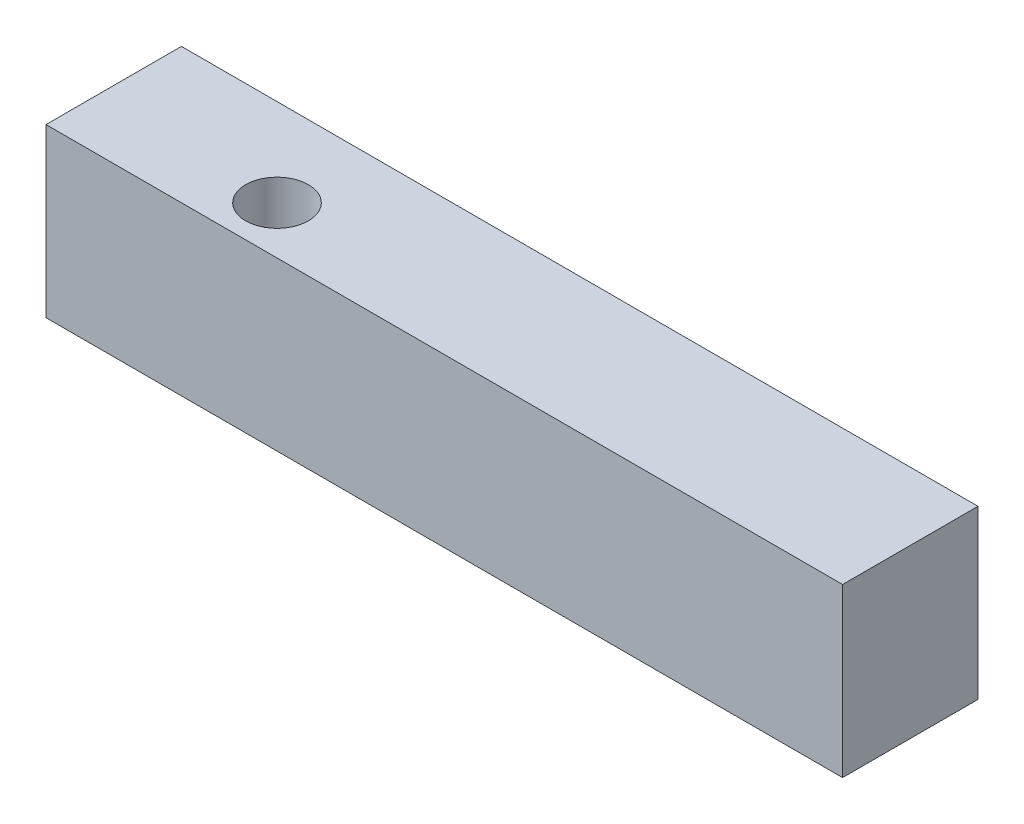
from build123d import *

# Parameters (mm, degrees)
SKETCH1_W           = 25.4
SKETCH1_H           = 5.334
BOSS_EXTRUDE1_DEPTH = 4.318
SKETCH2_R           = 1
CUT_EXTRUDE2_DEPTH  = 22.718057664


with BuildPart() as part:
    # Sketch1 → Boss-Extrude1 (new body)
    with BuildSketch(Plane.XY):
        with Locations((7.905274778, -0.284534644)):
            Rectangle(SKETCH1_W, SKETCH1_H)
    extrude(amount=BOSS_EXTRUDE1_DEPTH)

    # Sketch2 → Cut-Extrude2 (cut, through all)
    with BuildSketch(Plane(origin=(0, 2.382465356, 0), x_dir=(1, 0, 0), z_dir=(0, 1, 0))):
        with Locations((1.047274778, -2.794)):
            Circle(SKETCH2_R)
    extrude(amount=-CUT_EXTRUDE2_DEPTH, mode=Mode.SUBTRACT)


solid = part.part
